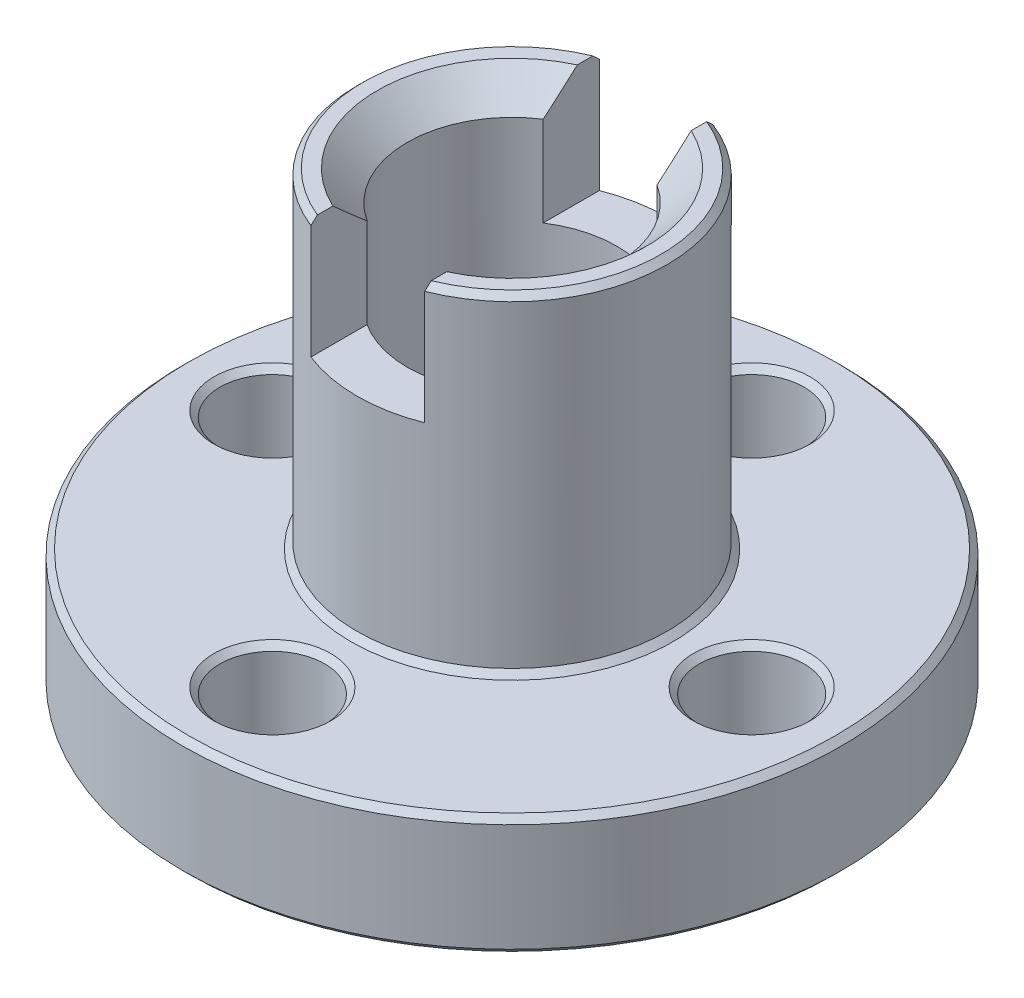
from build123d import *

# Parameters (mm, degrees)
CUT_EXTRUDE_1_DEPTH      = 22.610182785
CUT_EXTRUDE_1_DEPTH_BACK = 22.610182785
SKETCH_3_W               = 3.8
SKETCH_3_H               = 4
SKETCH_4_R               = 1.75
CUT_EXTRUDE_2_DEPTH      = 4
CHAMFER_1_SIZE           = 1
CHAMFER_2_SIZE           = 0.2


with BuildPart() as part:
    # Эскиз2 → Повернуть1 (revolve)
    with BuildSketch(Plane(origin=(0, 0, 0), x_dir=(0, 0, -1), z_dir=(1, 0, 0))):
        Polygon((3.5, 15), (3.5, 0), (11, 0), (11, 4), (5.175, 4), (5.175, 15), align=None)
    revolve(axis=Axis((0, 40.815789474, 0), (0, -1, 0)))

    # Эскиз3 → Вырез-Вытянуть1 (cut, two sides: drawn at the far end of the back side and taken through both)
    with BuildSketch(Plane.XY.offset(-CUT_EXTRUDE_1_DEPTH_BACK)):
        with Locations((0, 13)):
            Rectangle(SKETCH_3_W, SKETCH_3_H)
    extrude(amount=CUT_EXTRUDE_1_DEPTH + CUT_EXTRUDE_1_DEPTH_BACK, mode=Mode.SUBTRACT)

    # Эскиз4 → Вырез-Вытянуть2 (cut)
    with BuildSketch(Plane.XZ):
        with Locations((0, 8)):
            Circle(SKETCH_4_R)
        with Locations((8, 0)):
            Circle(SKETCH_4_R)
        with Locations((0, -8)):
            Circle(SKETCH_4_R)
        with Locations((-8, 0)):
            Circle(SKETCH_4_R)
    extrude(amount=-CUT_EXTRUDE_2_DEPTH, mode=Mode.SUBTRACT)

    # Фаска1
    chamfer_1_edges = [part.edges().sort_by_distance(p)[0] for p in [
        (3.5, 15, 0),
        (-3.5, 15, 0),
        (0, 0, 3.5),
    ]]
    chamfer(chamfer_1_edges, length=CHAMFER_1_SIZE)

    # Фаска2
    chamfer_2_edges = [part.edges().sort_by_distance(p)[0] for p in [
        (-1.75, 0, -8),
        (-1.75, 4, -8),
        (6.25, 0, 0),
        (6.25, 4, 0),
        (-9.75, 0, 0),
        (-9.75, 4, 0),
        (-1.75, 0, 8),
        (-1.75, 4, 8),
        (0, 0, 11),
        (0, 4, 11),
        (0, 4, 5.175),
        (5.175, 15, 0),
        (-5.175, 15, 0),
    ]]
    chamfer(chamfer_2_edges, length=CHAMFER_2_SIZE)


solid = part.part
